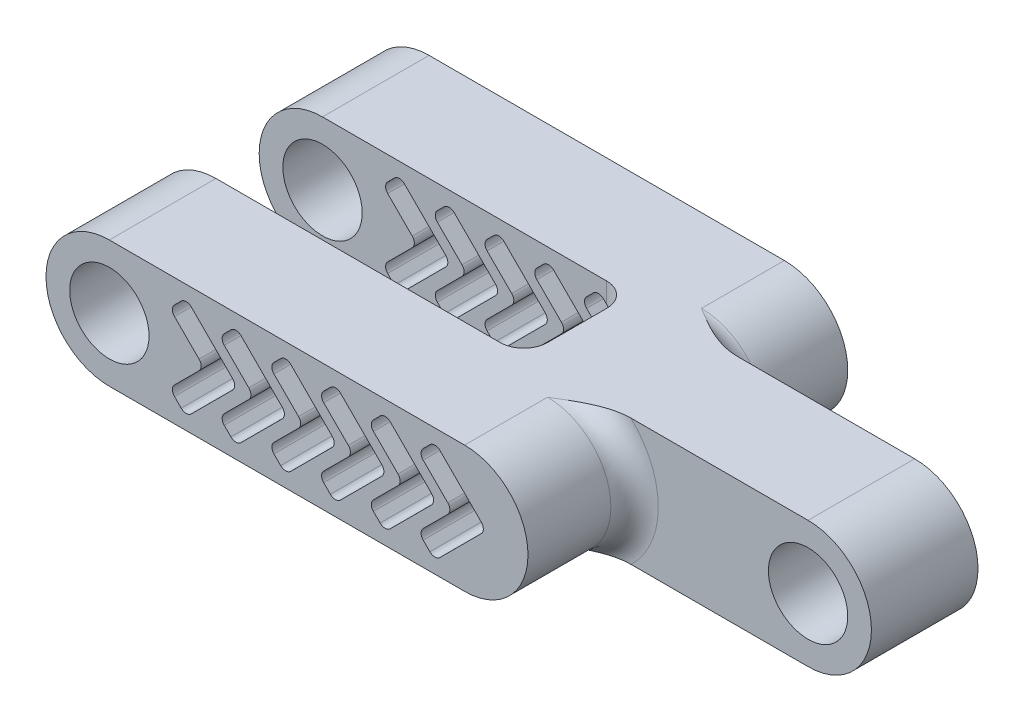
from build123d import *

# Parameters (mm, degrees)
SKETCH1_R                = 1.675
BOSS_EXTRUDE1_DEPTH      = 2.25
BOSS_EXTRUDE2_DEPTH      = 4.5
BOSS_EXTRUDE2_DEPTH_BACK = 9
SKETCH2_R                = 1.675
SKETCH3_W                = 15.675
SKETCH3_H                = 5.35
CUT_EXTRUDE3_DEPTH       = 2.25
CUT_EXTRUDE2_DEPTH       = 23.401143944
LPATTERN1_COUNT          = 6
LPATTERN1_PITCH          = 2.1
FILLET1_R                = 1


with BuildPart() as part:
    # Sketch1 → Boss-Extrude1 (new, symmetric)
    with BuildSketch(Plane.XY):
        with BuildLine():
            Line((0, 2.675), (15, 2.675))
            ThreePointArc((15, 2.675), (17.675, 0), (15, -2.675))
            Line((15, -2.675), (0, -2.675))
            ThreePointArc((0, -2.675), (-2.675, 0), (0, 2.675))
        make_face()
        Circle(SKETCH1_R, mode=Mode.SUBTRACT)
        with Locations((5, 0)):
            Circle(SKETCH1_R, mode=Mode.SUBTRACT)
        with Locations((15, 0)):
            Circle(SKETCH1_R, mode=Mode.SUBTRACT)
    extrude(amount=BOSS_EXTRUDE1_DEPTH, both=True)

    # Sketch2 → Boss-Extrude2 (add, two sides: drawn at the far end of the back side and taken through both)
    with BuildSketch(Plane.XY.offset(2.25).offset(-BOSS_EXTRUDE2_DEPTH_BACK)):
        with BuildLine():
            Line((5, -2.675), (-10, -2.675))
            ThreePointArc((-10, -2.675), (-12.675, 0), (-10, 2.675))
            Line((-10, 2.675), (5, 2.675))
            ThreePointArc((5, 2.675), (7.675, 0), (5, -2.675))
        make_face()
        with Locations((-10, 0)):
            Circle(SKETCH2_R, mode=Mode.SUBTRACT)
    extrude(amount=BOSS_EXTRUDE2_DEPTH + BOSS_EXTRUDE2_DEPTH_BACK)

    # Sketch3 → Cut-Extrude3 (cut, symmetric)
    with BuildSketch(Plane.XY):
        with Locations((-4.8375, 0)):
            Rectangle(SKETCH3_W, SKETCH3_H)
    extrude(amount=CUT_EXTRUDE3_DEPTH, both=True, mode=Mode.SUBTRACT)

    # Sketch4 → Cut-Extrude2 (cut, symmetric)
    with BuildSketch(Plane.XY.offset(6.75)):
        with BuildLine():
            Line((-6.967157288, 1.957106781), (-7.25, 1.674264069))
            ThreePointArc((-7.25, 1.674264069), (-7.337867966, 1.462132034), (-7.25, 1.25))
            Line((-7.25, 1.25), (-6.212132034, 0.212132034))
            ThreePointArc((-6.212132034, 0.212132034), (-6.124264069, 0), (-6.212132034, -0.212132034))
            Line((-6.212132034, -0.212132034), (-7.25, -1.25))
            ThreePointArc((-7.25, -1.25), (-7.337867966, -1.462132034), (-7.25, -1.674264069))
            Line((-7.25, -1.674264069), (-6.967157288, -1.957106781))
            ThreePointArc((-6.967157288, -1.957106781), (-6.755025253, -2.044974747), (-6.542893219, -1.957106781))
            Line((-6.542893219, -1.957106781), (-4.797918472, -0.212132034))
            ThreePointArc((-4.797918472, -0.212132034), (-4.710050506, 0), (-4.797918472, 0.212132034))
            Line((-4.797918472, 0.212132034), (-6.542893219, 1.957106781))
            ThreePointArc((-6.542893219, 1.957106781), (-6.755025253, 2.044974747), (-6.967157288, 1.957106781))
        make_face()
    cut_extrude2 = extrude(amount=CUT_EXTRUDE2_DEPTH, both=True, mode=Mode.SUBTRACT)

    # LPattern1: Cut-Extrude2 ×6
    with Locations(*[(i * LPATTERN1_PITCH, 0, 0) for i in range(1, LPATTERN1_COUNT)]):
        add(cut_extrude2, mode=Mode.SUBTRACT)

    # Fillet1
    # the kernel refuses this fillet: 1 mm, written as the material it adds along each edge
    with BuildSketch(Plane(origin=(3, 2.675, 2.25), x_dir=(-1, 0, 0), z_dir=(0, -1, 0))) as fillet1_piece_1_section:
        with BuildLine():
            CenterArc((FILLET1_R, FILLET1_R), FILLET1_R, 180, 90)
            Line((0, FILLET1_R), (0, 0))
            Line((0, 0), (FILLET1_R, 0))
        make_face()
    fillet1_piece_1 = extrude(amount=4.360786438, mode=Mode.PRIVATE)
    fillet1_piece_1 = split(fillet1_piece_1, bisect_by=Plane(origin=(2.383381447, 1.430832116, 2.014000402), z_dir=(0.7071067811865476, 0.7071067811865476, 0)), keep=Keep.TOP, mode=Mode.PRIVATE)
    add(fillet1_piece_1)
    with BuildSketch(Plane(origin=(3, 5.175, 2.25), x_dir=(-1, 0, 0), z_dir=(0, -1, 0))) as fillet1_piece_2_section:
        with BuildLine():
            CenterArc((FILLET1_R, FILLET1_R), FILLET1_R, 180, 90)
            Line((0, FILLET1_R), (0, 0))
            Line((0, 0), (FILLET1_R, 0))
        make_face()
    fillet1_piece_2 = extrude(amount=6.860786438, mode=Mode.PRIVATE)
    fillet1_piece_2 = split(fillet1_piece_2, bisect_by=Plane(origin=(2.65521473, -1.158998832, 1.994744159), z_dir=(0.7071067811865482, -0.7071067811865469, 0)), keep=Keep.TOP, mode=Mode.PRIVATE)
    add(fillet1_piece_2)
    with BuildSketch(Plane(origin=(3, 2.675, -2.25), x_dir=(-1, 0, 0), z_dir=(0, -1, 0))) as fillet1_piece_3_section:
        with BuildLine():
            CenterArc((FILLET1_R, -FILLET1_R), FILLET1_R, 90, 90)
            Line((0, -FILLET1_R), (0, 0))
            Line((0, 0), (FILLET1_R, 0))
        make_face()
    fillet1_piece_3 = extrude(amount=4.360786438, mode=Mode.PRIVATE)
    fillet1_piece_3 = split(fillet1_piece_3, bisect_by=Plane(origin=(2.383381447, 1.430832116, -2.014000402), z_dir=(0.7071067811865476, 0.7071067811865476, 0)), keep=Keep.TOP, mode=Mode.PRIVATE)
    add(fillet1_piece_3)
    with BuildSketch(Plane(origin=(3, 5.175, -2.25), x_dir=(-1, 0, 0), z_dir=(0, -1, 0))) as fillet1_piece_4_section:
        with BuildLine():
            CenterArc((FILLET1_R, -FILLET1_R), FILLET1_R, 90, 90)
            Line((0, -FILLET1_R), (0, 0))
            Line((0, 0), (FILLET1_R, 0))
        make_face()
    fillet1_piece_4 = extrude(amount=6.860786438, mode=Mode.PRIVATE)
    fillet1_piece_4 = split(fillet1_piece_4, bisect_by=Plane(origin=(2.65521473, -1.158998832, -1.994744159), z_dir=(0.7071067811865482, -0.7071067811865469, 0)), keep=Keep.TOP, mode=Mode.PRIVATE)
    add(fillet1_piece_4)
    with BuildSketch(Plane(origin=(5, 0, -2.25), x_dir=(-0.8052413674050118, 0.5929471647792127, 0), z_dir=(-0.5929471647792127, -0.8052413674050118, 0))) as fillet1_piece_5_section:
        with BuildLine():
            CenterArc((2.675 + FILLET1_R, FILLET1_R), FILLET1_R, 180, 90)
            Line((2.675 + FILLET1_R, 0), (2.675, 0))
            Line((2.675, 0), (2.675, FILLET1_R))
        make_face()
    fillet1_piece_5 = revolve(axis=Axis((5, 0, -2.25), (0, 0, -1)), revolution_arc=287.267143851, mode=Mode.PRIVATE)
    fillet1_piece_5 = split(fillet1_piece_5, bisect_by=Plane(origin=(7.959793112, -2.675, -2.534793112), z_dir=(0, 1, 0)), keep=Keep.TOP, mode=Mode.PRIVATE)
    fillet1_piece_5 = split(fillet1_piece_5, bisect_by=Plane(origin=(7.959793112, 2.675, -2.534793112), z_dir=(0, -1, 0)), keep=Keep.TOP, mode=Mode.PRIVATE)
    add(fillet1_piece_5)
    with BuildSketch(Plane(origin=(5, 0, 2.25), x_dir=(-0.8052413674050118, 0.5929471647792127, 0), z_dir=(-0.5929471647792127, -0.8052413674050118, 0))) as fillet1_piece_6_section:
        with BuildLine():
            CenterArc((2.675 + FILLET1_R, -FILLET1_R), FILLET1_R, 90, 90)
            Line((2.675, -FILLET1_R), (2.675, 0))
            Line((2.675, 0), (2.675 + FILLET1_R, 0))
        make_face()
    fillet1_piece_6 = revolve(axis=Axis((5, 0, 2.25), (0, 0, -1)), revolution_arc=287.267143851, mode=Mode.PRIVATE)
    fillet1_piece_6 = split(fillet1_piece_6, bisect_by=Plane(origin=(7.686455281, -2.675, 2.7500003), z_dir=(0, 1, 0)), keep=Keep.TOP, mode=Mode.PRIVATE)
    fillet1_piece_6 = split(fillet1_piece_6, bisect_by=Plane(origin=(7.686455281, 2.675, 2.7500003), z_dir=(0, -1, 0)), keep=Keep.TOP, mode=Mode.PRIVATE)
    add(fillet1_piece_6)
    with BuildSketch(Plane(origin=(3, 1.685786438, 2.25), x_dir=(-1, 0, 0), z_dir=(0, -1, 0))) as fillet1_piece_7_section:
        with BuildLine():
            CenterArc((FILLET1_R, FILLET1_R), FILLET1_R, 180, 90)
            Line((0, FILLET1_R), (0, 0))
            Line((0, 0), (FILLET1_R, 0))
        make_face()
    fillet1_piece_7 = extrude(amount=6.860786438, mode=Mode.PRIVATE)
    fillet1_piece_7 = split(fillet1_piece_7, bisect_by=Plane(origin=(2.65521473, 1.158998832, 1.994744159), z_dir=(0.7071067811865476, 0.7071067811865476, 0)), keep=Keep.TOP, mode=Mode.PRIVATE)
    add(fillet1_piece_7)
    with BuildSketch(Plane(origin=(3, 1.685786438, 2.25), x_dir=(-1, 0, 0), z_dir=(0, -1, 0))) as fillet1_piece_8_section:
        with BuildLine():
            CenterArc((FILLET1_R, FILLET1_R), FILLET1_R, 180, 90)
            Line((0, FILLET1_R), (0, 0))
            Line((0, 0), (FILLET1_R, 0))
        make_face()
    fillet1_piece_8 = extrude(amount=4.360786438, mode=Mode.PRIVATE)
    fillet1_piece_8 = split(fillet1_piece_8, bisect_by=Plane(origin=(2.383381447, -1.430832116, 2.014000402), z_dir=(0.7071067811865482, -0.7071067811865469, 0)), keep=Keep.TOP, mode=Mode.PRIVATE)
    add(fillet1_piece_8)
    with BuildSketch(Plane(origin=(3, 1.685786438, -2.25), x_dir=(0, 0, 1), z_dir=(0, -1, 0))) as fillet1_piece_9_section:
        with BuildLine():
            CenterArc((FILLET1_R, FILLET1_R), FILLET1_R, 180, 90)
            Line((0, FILLET1_R), (0, 0))
            Line((0, 0), (FILLET1_R, 0))
        make_face()
    fillet1_piece_9 = extrude(amount=6.860786438, mode=Mode.PRIVATE)
    fillet1_piece_9 = split(fillet1_piece_9, bisect_by=Plane(origin=(2.65521473, 1.158998832, -1.994744159), z_dir=(0.7071067811865476, 0.7071067811865476, 0)), keep=Keep.TOP, mode=Mode.PRIVATE)
    add(fillet1_piece_9)
    with BuildSketch(Plane(origin=(3, 1.685786438, -2.25), x_dir=(0, 0, 1), z_dir=(0, -1, 0))) as fillet1_piece_10_section:
        with BuildLine():
            CenterArc((FILLET1_R, FILLET1_R), FILLET1_R, 180, 90)
            Line((0, FILLET1_R), (0, 0))
            Line((0, 0), (FILLET1_R, 0))
        make_face()
    fillet1_piece_10 = extrude(amount=4.360786438, mode=Mode.PRIVATE)
    fillet1_piece_10 = split(fillet1_piece_10, bisect_by=Plane(origin=(2.383381447, -1.430832116, -2.014000402), z_dir=(0.7071067811865482, -0.7071067811865469, 0)), keep=Keep.TOP, mode=Mode.PRIVATE)
    add(fillet1_piece_10)


solid = part.part
